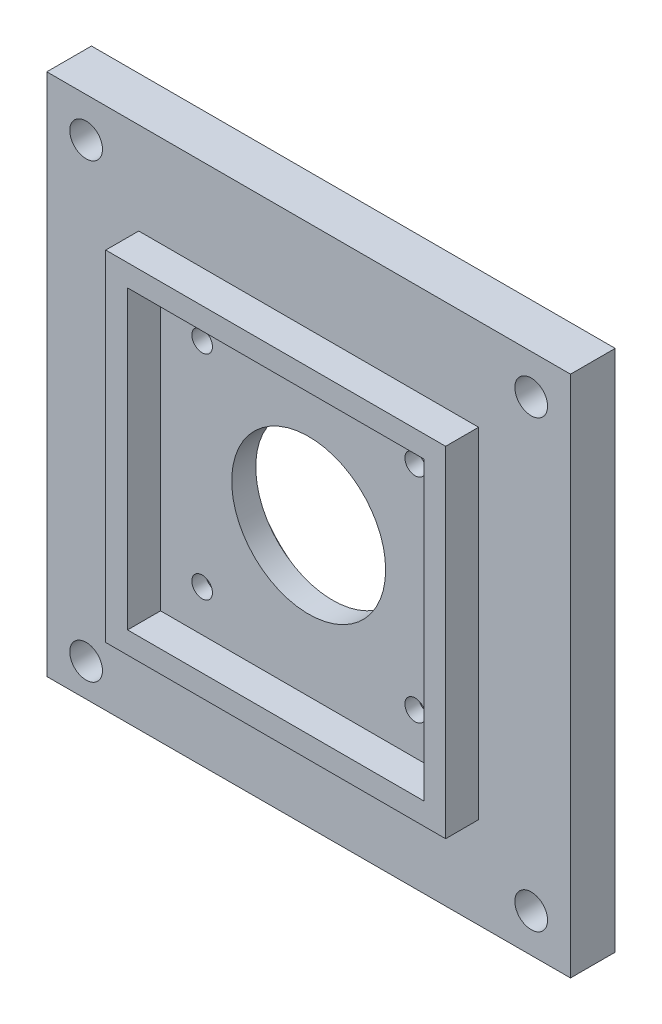
from build123d import *

# Parameters (mm, degrees)
SKETCH5_W      = 49.45
SKETCH5_H      = 49.45
SKETCH5_W_2    = 43.1
SKETCH5_H_2    = 43.1
EXTRUDE1_DEPTH = 4.8
SKETCH6_R      = 1.5
SKETCH6_R_2    = 2.38125
SKETCH6_R_3    = 11.2
EXTRUDE2_DEPTH = 6.5
SKETCH7_R      = 6
EXTRUDE3_DEPTH = 4.5
SKETCH8_R      = 6
EXTRUDE4_DEPTH = 3.5
SKETCH9_R      = 15.3625
EXTRUDE5_DEPTH = 3


with BuildPart() as part:
    # Sketch5 → Extrude1 (new body)
    with BuildSketch(Plane.XY):
        with Locations((-46.55, 0)):
            Rectangle(SKETCH5_W, SKETCH5_H)
        with Locations((-46.55, 0)):
            Rectangle(SKETCH5_W_2, SKETCH5_H_2, mode=Mode.SUBTRACT)
    extrude(amount=EXTRUDE1_DEPTH)

    # Sketch6 → Extrude2 (add)
    with BuildSketch(Plane(origin=(0, 0, 0), x_dir=(-1, 0, 0), z_dir=(0, 0, -1))):
        Polygon((8.45, 38.1), (8.45, -37.987007671), (84.65, -38.1), (84.65, 38.1), align=None)
        with Locations((62.05, 15.5)):
            Circle(SKETCH6_R, mode=Mode.SUBTRACT)
        with Locations((31.05, 15.5)):
            Circle(SKETCH6_R, mode=Mode.SUBTRACT)
        with Locations((62.05, -15.5)):
            Circle(SKETCH6_R, mode=Mode.SUBTRACT)
        with Locations((31.05, -15.5)):
            Circle(SKETCH6_R, mode=Mode.SUBTRACT)
        with Locations((14.17, 32.38)):
            Circle(SKETCH6_R_2, mode=Mode.SUBTRACT)
        with Locations((78.93, 32.38)):
            Circle(SKETCH6_R_2, mode=Mode.SUBTRACT)
        with Locations((78.93, -33.309394929)):
            Circle(SKETCH6_R_2, mode=Mode.SUBTRACT)
        with Locations((14.17, -32.38)):
            Circle(SKETCH6_R_2, mode=Mode.SUBTRACT)
        with Locations((46.55, 0)):
            Circle(SKETCH6_R_3, mode=Mode.SUBTRACT)
    extrude(amount=EXTRUDE2_DEPTH)

    # Sketch7 → Extrude3 (cut)
    with BuildSketch(Plane(origin=(0, 0, -6.5), x_dir=(-1, 0, 0), z_dir=(0, 0, -1))):
        with Locations((62.05, -15.5)):
            Circle(SKETCH7_R)
        with Locations((31.05, -15.5)):
            Circle(SKETCH7_R)
    extrude(amount=-EXTRUDE3_DEPTH, mode=Mode.SUBTRACT)

    # Sketch8 → Extrude4 (cut)
    with BuildSketch(Plane(origin=(0, 0, -6.5), x_dir=(-1, 0, 0), z_dir=(0, 0, -1))):
        with Locations((62.05, 15.5)):
            Circle(SKETCH8_R)
        with Locations((31.05, 15.5)):
            Circle(SKETCH8_R)
    extrude(amount=-EXTRUDE4_DEPTH, mode=Mode.SUBTRACT)

    # Sketch9 → Extrude5 (cut)
    with BuildSketch(Plane(origin=(0, 0, -6.5), x_dir=(-1, 0, 0), z_dir=(0, 0, -1))):
        with Locations((46.55, 0)):
            Circle(SKETCH9_R)
    extrude(amount=-EXTRUDE5_DEPTH, mode=Mode.SUBTRACT)


solid = part.part
